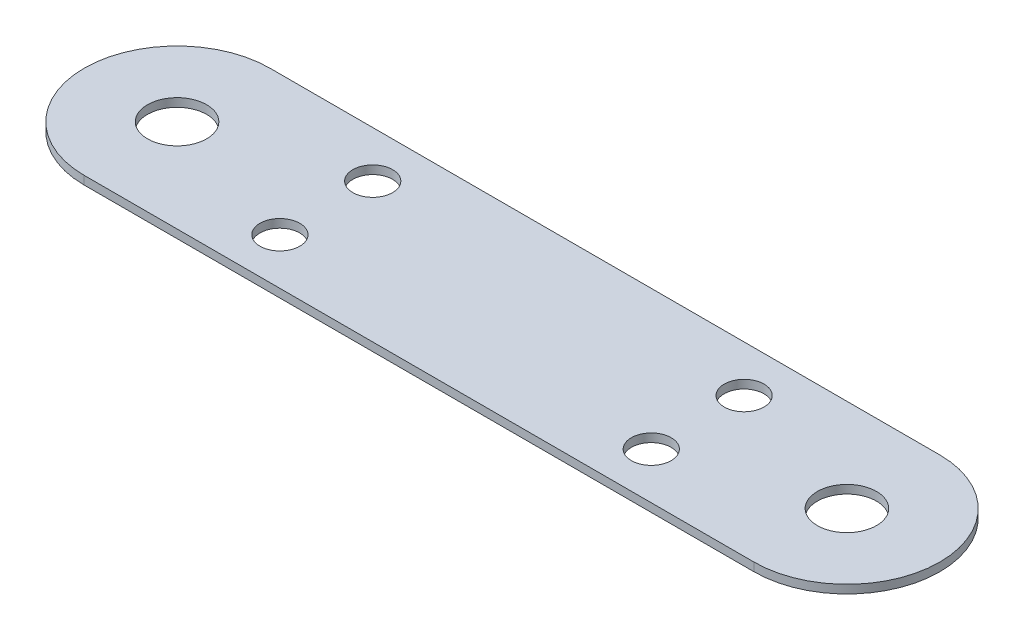
from build123d import *

# Parameters (mm, degrees)
SKETCH1_R           = 7.5
SKETCH1_R_2         = 11.15
BOSS_EXTRUDE1_DEPTH = 3.175


with BuildPart() as part:
    # Sketch1 → Boss-Extrude1 (new body)
    with BuildSketch(Plane(origin=(0, 0, 0), x_dir=(1, 0, 0), z_dir=(0, 1, 0))):
        with BuildLine():
            Line((126.258214395, 35), (-126.258214395, 35))
            ThreePointArc((-126.258214395, 35), (-161.258214395, 0), (-126.258214395, -35))
            Line((-126.258214395, -35), (126.258214395, -35))
            ThreePointArc((126.258214395, -35), (161.258214395, 0), (126.258214395, 35))
        make_face()
        with Locations((-70, 17.5)):
            Circle(SKETCH1_R, mode=Mode.SUBTRACT)
        with Locations((70, 17.5)):
            Circle(SKETCH1_R, mode=Mode.SUBTRACT)
        with Locations((-126.258214395, 0)):
            Circle(SKETCH1_R_2, mode=Mode.SUBTRACT)
        with Locations((126.258214395, 0)):
            Circle(SKETCH1_R_2, mode=Mode.SUBTRACT)
        with Locations((70, -17.5)):
            Circle(SKETCH1_R, mode=Mode.SUBTRACT)
        with Locations((-70, -17.5)):
            Circle(SKETCH1_R, mode=Mode.SUBTRACT)
    extrude(amount=BOSS_EXTRUDE1_DEPTH)


solid = part.part
